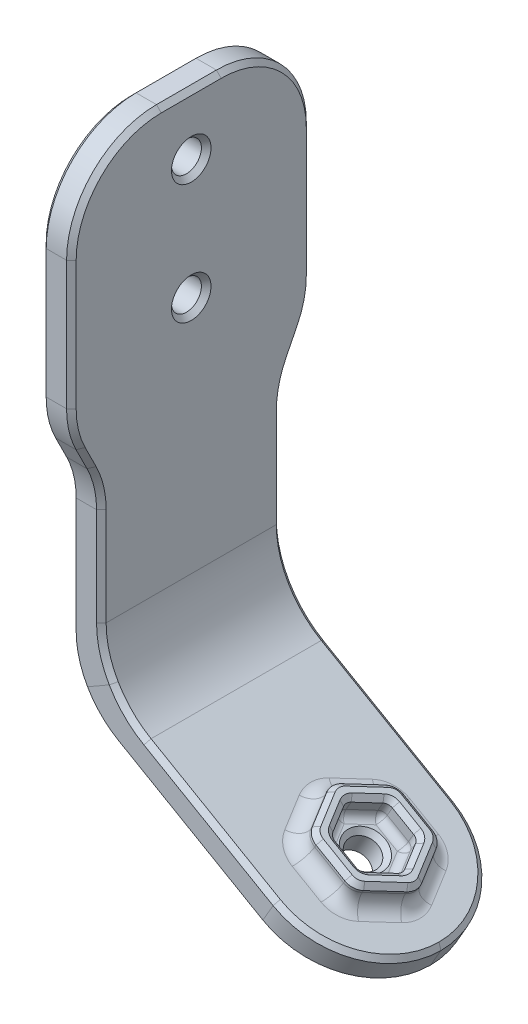
from build123d import *

# Parameters (mm, degrees)
SKETCH2_W           = 3.175
SKETCH2_H           = 19.05
BOSS_EXTRUDE1_DEPTH = 3.175
CUT_EXTRUDE1_REACH  = 77.397
SKETCH3_R           = 1.5875
CUT_EXTRUDE2_REACH  = 64.926
SKETCH5_R           = 1.5875
BOSS_EXTRUDE2_DEPTH = 2.38125
FILLET1_R           = 9.525
FILLET2_R           = 9.525
FILLET3_R           = 9.525
FILLET4_R           = 1.5875
FILLET5_R           = 0.79375
CHAMFER1_SIZE       = 0.508


with BuildPart() as part:
    # Sweep1: sweep along a path in Sketch1
    with BuildLine(Plane.XY) as sweep1_path:
        Line((0, 0), (0, -31.75))
        Line((0, -31.75), (0, -50.8))
        Line((0, -50.8), (27.49630657, -66.675))
    # Sketch2 → Sweep1 (sweep)
    with BuildSketch(Plane(origin=(0, 0, 0), x_dir=(1, 0, 0), z_dir=(0, 1, 0))):
        Rectangle(SKETCH2_W, SKETCH2_H)
    sweep(path=sweep1_path.line, transition=Transition.RIGHT)

    # Sketch4 → Boss-Extrude1 (add)
    with BuildSketch(Plane.ZY.offset(1.5875)):
        Polygon((-12.7, -25.4), (-9.525, -31.75), (9.525, -31.75), (12.7, -25.4), (12.7, 0), (-12.7, 0), align=None)
    extrude(amount=-BOSS_EXTRUDE1_DEPTH)

    # Sketch3 → Cut-Extrude1 (cut, up to next)
    with BuildSketch(Plane.ZY.offset(1.5875), mode=Mode.PRIVATE) as cut_extrude1_sk1:
        with Locations(Location((0, -6.35, 0), (0, 0, 270))):
            Circle(SKETCH3_R)
    cut_extrude1_tool1 = extrude(cut_extrude1_sk1.sketch, amount=-CUT_EXTRUDE1_REACH, mode=Mode.PRIVATE) & part.part
    # Sketch3 → Cut-Extrude1 (cut, up to next)
    with BuildSketch(Plane.ZY.offset(1.5875), mode=Mode.PRIVATE) as cut_extrude1_sk2:
        with Locations(Location((0, -19.05, 0), (0, 0, 270))):
            Circle(SKETCH3_R)
    cut_extrude1_tool2 = extrude(cut_extrude1_sk2.sketch, amount=-CUT_EXTRUDE1_REACH, mode=Mode.PRIVATE) & part.part
    add(cut_extrude1_tool1.solids().sort_by_distance((-1.5875, -6.35, 0))[0], mode=Mode.SUBTRACT)
    add(cut_extrude1_tool2.solids().sort_by_distance((-1.5875, -19.05, 0))[0], mode=Mode.SUBTRACT)

    # Sketch5 → Cut-Extrude2 (cut, up to next)
    with BuildSketch(Plane(origin=(-21.203295256, -36.725184671, 0), x_dir=(0.86602540378444, -0.4999999999999976, 0), z_dir=(0.4999999999999977, 0.8660254037844402, 0)), mode=Mode.PRIVATE) as cut_extrude2_sk1:
        with Locations(Location((47.625, 0, 0), (0, 0, 180))):
            Circle(SKETCH5_R)
    cut_extrude2_tool1 = extrude(cut_extrude2_sk1.sketch, amount=-CUT_EXTRUDE2_REACH, mode=Mode.PRIVATE) & part.part
    add(cut_extrude2_tool1.solids().sort_by_distance((20.041165, -60.537685, 0))[0], mode=Mode.SUBTRACT)

    # Sketch6 → Boss-Extrude2 (add)
    with BuildSketch(Plane(origin=(-21.203295256, -36.725184671, 0), x_dir=(0.86602540378444, -0.4999999999999976, 0), z_dir=(0.4999999999999977, 0.8660254037844402, 0))):
        Polygon((50.301307173, 4.6355), (44.948692827, 4.6355), (42.272385654, 0), (44.948692827, -4.6355), (50.301307173, -4.6355), (52.977614346, 0), align=None)
        Polygon((49.38476362, 3.048), (45.86523638, 3.048), (44.105472759, 0), (45.86523638, -3.048), (49.38476362, -3.048), (51.144527241, 0), align=None, mode=Mode.SUBTRACT)
    extrude(amount=BOSS_EXTRUDE2_DEPTH)

    # Fillet1
    fillet1_edges = [part.edges().sort_by_distance(p)[0] for p in [
        (27.49630657, -66.675, -9.525),
        (27.49630657, -66.675, 9.525),
    ]]
    fillet(fillet1_edges, radius=FILLET1_R - 0.0001)  # a hair under: the kernel refuses the full size

    # Fillet2
    fillet2_edges = [part.edges().sort_by_distance(p)[0] for p in [
        (1.5875, -49.883456448, 0),
        (-1.5875, -51.716543552, 0),
    ]]
    fillet(fillet2_edges, radius=FILLET2_R)

    # Fillet3
    fillet3_edges = [part.edges().sort_by_distance(p)[0] for p in [
        (0, 0, -12.7),
        (0, -25.4, -12.7),
        (0, 0, 12.7),
        (0, -25.4, 12.7),
        (0, -31.75, -9.525),
        (0, -31.75, 9.525),
    ]]
    fillet(fillet3_edges, radius=FILLET3_R)

    # Fillet4
    fillet4_edges = [part.edges().sort_by_distance(p)[0] for p in [
        (23.517789599, -62.544915051, -2.31775),
        (25.271977099, -62.182880348, 0),
        (20.041164599, -60.537684671, -4.6355),
        (22.954227099, -60.844726762, -4.6355),
        (16.564539599, -58.530454292, -2.31775),
        (18.318727099, -58.168419589, -4.6355),
        (16.564539599, -58.530454292, 2.31775),
        (16.000977099, -56.830266002, 0),
        (20.041164599, -60.537684671, 4.6355),
        (18.318727099, -58.168419589, 4.6355),
        (23.517789599, -62.544915051, 2.31775),
        (22.954227099, -60.844726762, 4.6355),
    ]]
    fillet(fillet4_edges, radius=FILLET4_R)

    # Fillet5
    fillet5_edges = [part.edges().sort_by_distance(p)[0] for p in [
        (22.327164599, -61.857507387, -1.524),
        (20.041164599, -60.537684671, -3.048),
        (17.755164599, -59.217861956, -1.524),
        (17.755164599, -59.217861956, 1.524),
        (20.041164599, -60.537684671, 3.048),
        (22.327164599, -61.857507387, 1.524),
        (22.160477099, -60.386454985, -3.048),
        (19.112477099, -58.626691365, -3.048),
        (17.588477099, -57.746809555, 0),
        (19.112477099, -58.626691365, 3.048),
        (22.160477099, -60.386454985, 3.048),
        (23.684477099, -61.266336796, 0),
    ]]
    fillet(fillet5_edges, radius=FILLET5_R)

    # Chamfer1
    chamfer1_edges = [part.edges().sort_by_distance(p)[0] for p in [
        (24.286537414, -66.654926019, 6.73522138),
        (24.286537414, -66.654926019, -6.73522138),
        (25.874037414, -63.905295362, 6.73522138),
        (25.874037414, -63.905295362, -6.73522138),
        (10.814375601, -58.876769769, -9.525),
        (10.814375601, -58.876769769, 9.525),
        (13.195625601, -56.585410888, -9.525),
        (-0.311391971, -50.979782238, -9.525),
        (-0.311391971, -50.979782238, -9.525),
        (-0.311391971, -50.979782238, 9.525),
        (13.195625601, -56.585410888, 9.525),
        (-0.311391971, -50.979782238, 9.525),
        (2.863608029, -49.146695134, 9.525),
        (2.863608029, -49.146695134, 9.525),
        (2.863608029, -49.146695134, -9.525),
        (2.863608029, -49.146695134, -9.525),
        (1.5875, 0, 0),
        (-1.5875, 0, 0),
        (-1.5875, -40.107914862, -9.525),
        (-1.5875, -40.107914862, 9.525),
        (-1.5875, -28.575, 11.1125),
        (-1.5875, -16.338226257, 12.7),
        (-1.5875, -16.338226257, -12.7),
        (-1.5875, -28.575, -11.1125),
        (-1.5875, -25.339849083, 12.445196625),
        (-1.5875, -25.339849083, -12.445196625),
        (-1.5875, -2.789807909, 9.910192091),
        (-1.5875, -2.789807909, -9.910192091),
        (1.5875, -16.338226257, -12.7),
        (1.5875, -39.19137131, 9.525),
        (1.5875, -39.19137131, -9.525),
        (1.5875, -28.575, -11.1125),
        (1.5875, -16.338226257, 12.7),
        (1.5875, -28.575, 11.1125),
        (1.5875, -25.339849083, 12.445196625),
        (1.5875, -25.339849083, -12.445196625),
        (1.5875, -2.789807909, 9.910192091),
        (1.5875, -2.789807909, -9.910192091),
        (-1.5875, -31.810150917, -9.779803375),
        (1.5875, -31.810150917, -9.779803375),
        (1.5875, -31.810150917, 9.779803375),
        (-1.5875, -31.810150917, 9.779803375),
        (24.708414599, -60.482692058, -2.31775),
        (24.708414599, -60.482692058, 2.31775),
        (21.231789599, -58.475461679, -4.6355),
        (17.755164599, -56.468231299, -2.31775),
        (17.755164599, -56.468231299, 2.31775),
        (21.231789599, -58.475461679, 4.6355),
        (23.443197263, -59.752218489, 4.422815329),
        (19.020381935, -57.198704868, 4.422815329),
        (23.443197263, -59.752218489, -4.422815329),
        (19.020381935, -57.198704868, -4.422815329),
        (16.808974271, -55.921948058, 0),
        (25.654604928, -61.028975299, 0),
        (21.231789599, -58.475461679, 3.048),
        (18.945789599, -57.155638963, 1.524),
        (21.231789599, -58.475461679, -3.048),
        (23.517789599, -59.795284394, -1.524),
        (23.517789599, -59.795284394, 1.524),
        (18.945789599, -57.155638963, -1.524),
        (18.290131935, -56.777094834, 0),
        (19.760960767, -57.626278257, 2.941657664),
        (22.702618431, -59.324645101, 2.941657664),
        (24.173447263, -60.173828523, 0),
        (22.702618431, -59.324645101, -2.941657664),
        (19.760960767, -57.626278257, -2.941657664),
        (-1.5875, -4.7625, 0),
        (1.5875, -4.7625, 0),
        (-1.5875, -17.4625, 0),
        (1.5875, -17.4625, 0),
        (21.415979928, -61.331434671, 0),
        (19.828479928, -64.081065329, 0),
    ]]
    chamfer(chamfer1_edges, length=CHAMFER1_SIZE)


solid = part.part
